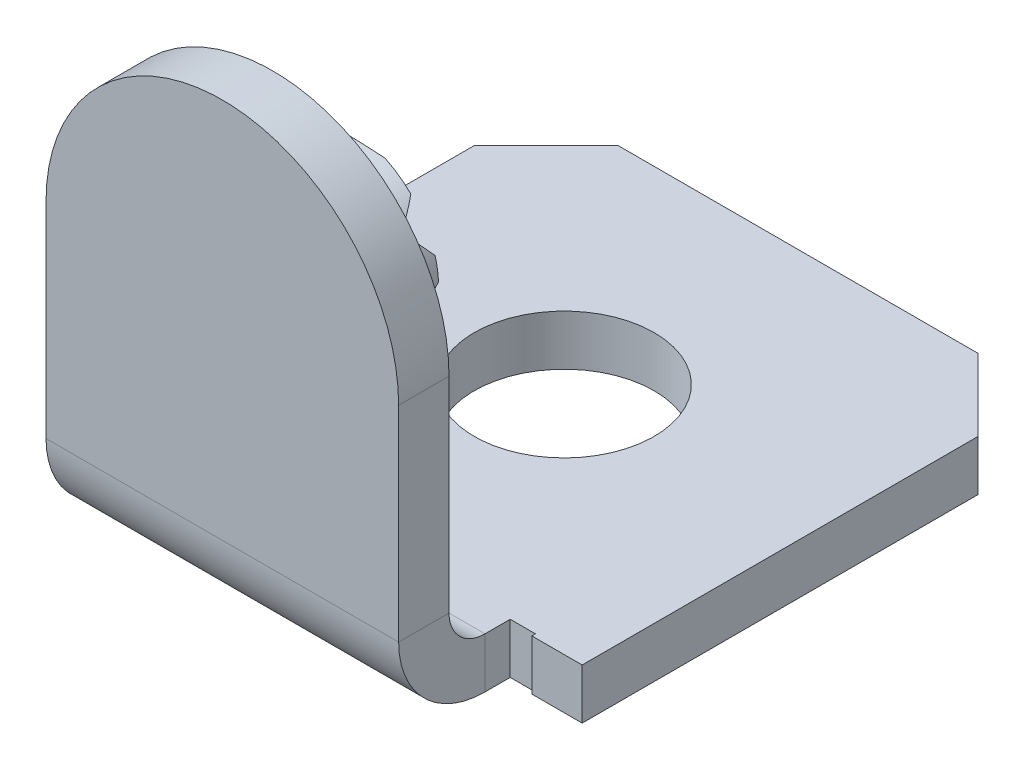
from build123d import *

# Parameters (mm, degrees)
BASE_FLANGE1_DEPTH       = 0.7
EDGE_FLANGE1_START       = -2.45
EDGE_FLANGE1_DEPTH       = 4.9
EDGE_FLANGE1_START_2     = -2.8
EDGE_FLANGE1_2_OUTLINE_W = 0.7
EDGE_FLANGE1_2_OUTLINE_H = 0.05
EDGE_FLANGE1_2_DEPTH     = 0.35
EDGE_FLANGE1_START_3     = 2.45
EDGE_FLANGE1_3_OUTLINE_W = 0.7
EDGE_FLANGE1_3_OUTLINE_H = 0.05
EDGE_FLANGE1_3_DEPTH     = 0.35
EDGE_FLANGE1_4_DEPTH     = 4.9
CUT_EXTRUDE1_DEPTH       = 10
SKETCH10_R               = 1
BOSS_EXTRUDE1_DEPTH      = 1
BOSS_EXTRUDE1_DRAFT      = -17
CUT_EXTRUDE2_DEPTH       = 10.571050099
CHAMFER1_SIZE            = 1
M3_TAPPED_HOLE1_D        = 2.5
M3_TAPPED_HOLE1_DEPTH    = 7.5
M3_TAPPED_HOLE1_TIP      = 0.751075774


# Read off the part's stored shape, not the designer's step: Edge-Flange1
# Sheet-metal steps are written as plain solids
with BuildPart() as part:
    # Sketch1 → Base-Flange1 (new body)
    with BuildSketch(Plane(origin=(0, 0, 0), x_dir=(1, 0, 0), z_dir=(0, 1, 0))):
        Polygon((-2.45, -3.25), (-3.5, -3.25), (-3.5, 3.25), (3.5, 3.25), (3.5, -3.25), (2.45, -3.25), (2.45, -4.75), (-2.45, -4.75), align=None)
    extrude(amount=-BASE_FLANGE1_DEPTH)

    # Edge-Flange1 outline → Edge-Flange1 (cut)
    with BuildSketch(Plane.YZ.offset(EDGE_FLANGE1_START)):
        with BuildLine():
            Line((-0.7, 4.75), (-0.7, 3.55))
            ThreePointArc((-0.7, 3.55), (-0.509950493, 4.198074069), (0, 4.640871211))
            Line((0, 4.640871211), (0, 4.75))
            Line((0, 4.75), (-0.7, 4.75))
        make_face()
    extrude(amount=EDGE_FLANGE1_DEPTH, mode=Mode.SUBTRACT)

    # Edge-Flange1 2 outline → Edge-Flange1 2 (cut)
    with BuildSketch(Plane.YZ.offset(EDGE_FLANGE1_START_2)):
        with Locations((-0.35, 3.225)):
            Rectangle(EDGE_FLANGE1_2_OUTLINE_W, EDGE_FLANGE1_2_OUTLINE_H)
    extrude(amount=EDGE_FLANGE1_2_DEPTH, mode=Mode.SUBTRACT)

    # Edge-Flange1 3 outline → Edge-Flange1 3 (cut)
    with BuildSketch(Plane.YZ.offset(EDGE_FLANGE1_START_3)):
        with Locations((-0.35, 3.225)):
            Rectangle(EDGE_FLANGE1_3_OUTLINE_W, EDGE_FLANGE1_3_OUTLINE_H)
    extrude(amount=EDGE_FLANGE1_3_DEPTH, mode=Mode.SUBTRACT)

    # Edge-Flange1 4 outline → Edge-Flange1 4 (add)
    with BuildSketch(Plane.YZ.offset(EDGE_FLANGE1_START)):
        with BuildLine():
            Line((0, 4.640871211), (0, 3.55))
            ThreePointArc((0, 3.55), (0.146446609, 3.903553391), (0.5, 4.05))
            Line((0.5, 4.05), (5.8, 4.05))
            Line((5.8, 4.05), (5.8, 4.75))
            Line((5.8, 4.75), (0.5, 4.75))
            ThreePointArc((0.5, 4.75), (0.244114727, 4.722400412), (0, 4.640871211))
        make_face()
    extrude(amount=EDGE_FLANGE1_4_DEPTH)

    # Sketch9 → Cut-Extrude1 (cut)
    with BuildSketch(Plane(origin=(0, 0, 4.05), x_dir=(-1, 0, 0), z_dir=(0, 0, -1))):
        with BuildLine():
            ThreePointArc((0, 5.8), (1.732411614, 5.082411614), (2.45, 3.35))
            Line((2.45, 3.35), (2.45, 5.8))
            Line((2.45, 5.8), (0, 5.8))
        make_face()
        with BuildLine():
            ThreePointArc((-2.45, 3.35), (-1.732411614, 5.082411614), (0, 5.8))
            Line((0, 5.8), (-2.45, 5.8))
            Line((-2.45, 5.8), (-2.45, 3.35))
        make_face()
    extrude(amount=-CUT_EXTRUDE1_DEPTH, mode=Mode.SUBTRACT)


with BuildPart() as boss_extrude1_tool:
    # Sketch10 → Boss-Extrude1 (with draft: the straight prism first)
    with BuildSketch(Plane(origin=(0, 0, 4.05), x_dir=(-1, 0, 0), z_dir=(0, 0, -1))):
        with Locations((0, 3.35)):
            Circle(SKETCH10_R)
    extrude(amount=BOSS_EXTRUDE1_DEPTH)
    # Boss-Extrude1: the draft: its side faces are tilted about the plane it starts from
    boss_extrude1_sides = [boss_extrude1_tool.faces().sort_by_distance(p)[0] for p in [
        (1, 3.35, 3.55),
    ]]
    draft(boss_extrude1_sides, Plane(origin=(0, 0, 4.05), x_dir=(-1, 0, 0), z_dir=(0, 0, -1)), BOSS_EXTRUDE1_DRAFT)


with BuildPart() as part_1:
    add(part.part)

    # Boss-Extrude1: add boss_extrude1_tool
    add(boss_extrude1_tool.part)

    # Sketch11 → Cut-Extrude2 (cut, through all)
    with BuildSketch(Plane(origin=(2.45, 0, 0), x_dir=(0, 0, -1), z_dir=(1, 0, 0))):
        Polygon((-3.254043784, 4.795439766), (-2.944980446, 4.391765202), (-3.304503105, 4.000705467), (-2.944980446, 3.584416072), (-3.254043784, 3.073515451), (-2.961297011, 2.691152319), (-3.254043784, 2.43832556), (-2.961297011, 2.261231833), (-3.304503105, 1.887919941), (-2.402542749, 1.887919941), (-2.522383636, 4.908973238), align=None)
    extrude(amount=-CUT_EXTRUDE2_DEPTH, mode=Mode.SUBTRACT)

    # Chamfer1
    chamfer1_edges = [part_1.edges().sort_by_distance(p)[0] for p in [
        (-3.5, -0.35, -3.25),
        (3.5, -0.35, -3.25),
    ]]
    chamfer(chamfer1_edges, length=CHAMFER1_SIZE)

    # M3 Tapped Hole1
    with Locations(Plane(origin=(0, -0.7, 0), x_dir=(-1, 0, 0), z_dir=(0, -1, 0))):
        with Locations((0, 0)):
            Hole(M3_TAPPED_HOLE1_D / 2, depth=M3_TAPPED_HOLE1_DEPTH)
            with Locations((0, 0, -(M3_TAPPED_HOLE1_DEPTH + M3_TAPPED_HOLE1_TIP / 2))):  # 118° drill point
                Cone(0, M3_TAPPED_HOLE1_D / 2, M3_TAPPED_HOLE1_TIP, mode=Mode.SUBTRACT)


solid = part_1.part
